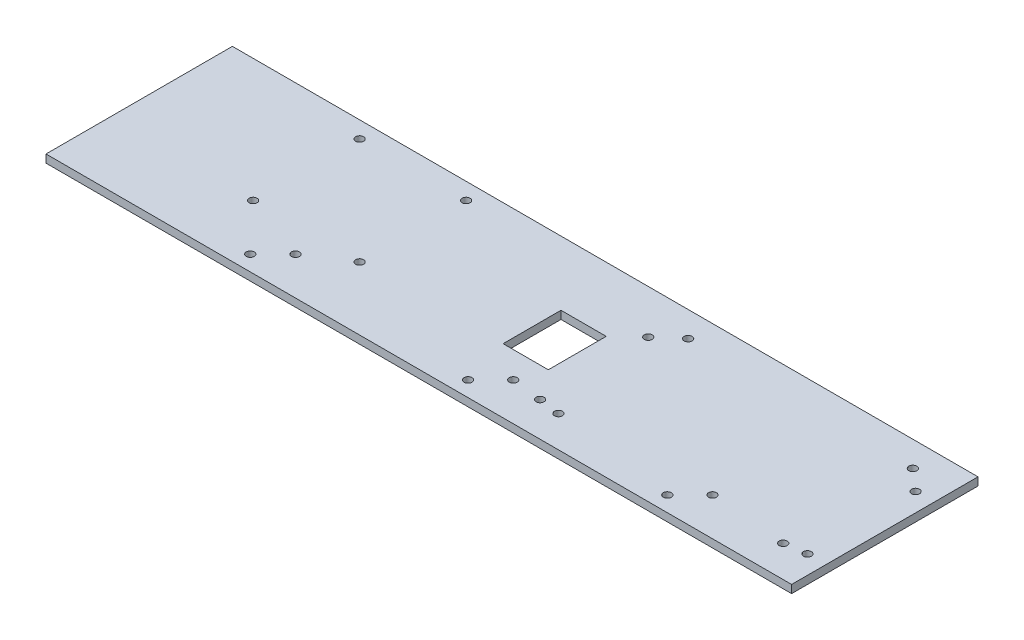
from build123d import *

# Parameters (mm, degrees)
SKETCH1_W           = 280
SKETCH1_H           = 70
SKETCH1_R           = 1.5
SKETCH1_W_2         = 16.970562749
SKETCH1_H_2         = 21.733264164
BOSS_EXTRUDE1_DEPTH = 3


with BuildPart() as part:
    # Sketch1 → Boss-Extrude1 (new body)
    with BuildSketch(Plane(origin=(0, 0, 0), x_dir=(1, 0, 0), z_dir=(0, 1, 0))):
        Rectangle(SKETCH1_W, SKETCH1_H)
        with Locations((87.571170369, -29.242640687)):
            Circle(SKETCH1_R, mode=Mode.SUBTRACT)
        with Locations((96.056451743, -20.757359313)):
            Circle(SKETCH1_R, mode=Mode.SUBTRACT)
        with Locations((32.64342059, 18.5)):
            Circle(SKETCH1_R, mode=Mode.SUBTRACT)
        with Locations((12.729398157, -29.242640687)):
            Circle(SKETCH1_R, mode=Mode.SUBTRACT)
        with Locations((21.214679531, -20.757359313)):
            Circle(SKETCH1_R, mode=Mode.SUBTRACT)
        with Locations((-60.567795503, -20.757359313)):
            Circle(SKETCH1_R, mode=Mode.SUBTRACT)
        with Locations((-69.053076877, -29.242640687)):
            Circle(SKETCH1_R, mode=Mode.SUBTRACT)
        with Locations((40.64342059, 25.5)):
            Circle(SKETCH1_R, mode=Mode.SUBTRACT)
        with Locations((32.64342059, -22.1)):
            Circle(SKETCH1_R, mode=Mode.SUBTRACT)
        with Locations((40.64342059, -23.2)):
            Circle(SKETCH1_R, mode=Mode.SUBTRACT)
        with Locations((125.04342059, -23.2)):
            Circle(SKETCH1_R, mode=Mode.SUBTRACT)
        with Locations((133.04342059, -22.1)):
            Circle(SKETCH1_R, mode=Mode.SUBTRACT)
        with Locations((133.04342059, 18.5)):
            Circle(SKETCH1_R, mode=Mode.SUBTRACT)
        with Locations((125.04342059, 25.5)):
            Circle(SKETCH1_R, mode=Mode.SUBTRACT)
        with Locations((-85.992560042, 28.748653915)):
            Circle(SKETCH1_R, mode=Mode.SUBTRACT)
        with Locations((-45.992560042, 28.748653915)):
            Circle(SKETCH1_R, mode=Mode.SUBTRACT)
        with Locations((-45.992560042, -11.251346085)):
            Circle(SKETCH1_R, mode=Mode.SUBTRACT)
        with Locations((-85.992560042, -11.251346085)):
            Circle(SKETCH1_R, mode=Mode.SUBTRACT)
        with Locations((16.016419574, 0)):
            Rectangle(SKETCH1_W_2, SKETCH1_H_2, mode=Mode.SUBTRACT)
    extrude(amount=BOSS_EXTRUDE1_DEPTH)


solid = part.part
